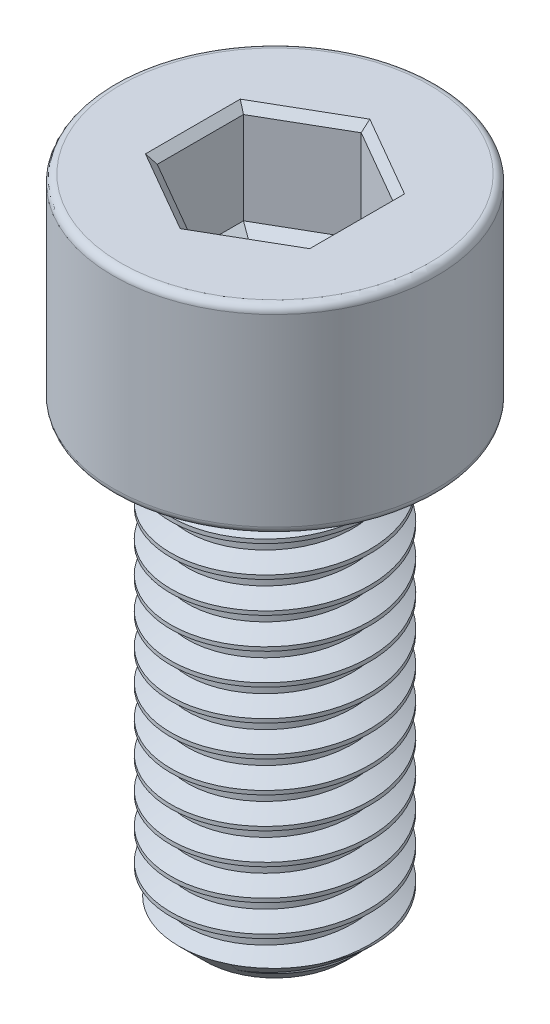
from build123d import *

# Parameters (mm, degrees)
SKETCH1_R           = 4
BOSS_EXTRUDE1_DEPTH = 18
THREAD1_PITCH       = 1.25
SKETCH2_R           = 6.5
BOSS_EXTRUDE2_DEPTH = 8
FILLET1_R           = 0.3
CUT_EXTRUDE1_DEPTH  = 4
CHAMFER1_SIZE       = 0.3
CUT_EXTRUDE2_DEPTH  = 0.4
CUT_EXTRUDE2_DRAFT  = -60


with BuildPart() as part:
    # Sketch1 → Boss-Extrude1 (new body)
    with BuildSketch(Plane(origin=(0, 0, 0), x_dir=(1, 0, 0), z_dir=(0, 1, 0))):
        with Locations(Location((0, 0, 0), (0, 0, 270))):
            Circle(SKETCH1_R)
    extrude(amount=BOSS_EXTRUDE1_DEPTH)

    # Thread1: the profile of Thread Profile1 profile screwed along a right-hand helix of 15.4 turns, 8 arcs to a turn; built about Z, then put on its axis
    thread1_z = Axis((0, 0, 0), (0, 0, 1))
    thread1_corners = [(4.0003, 0, -0.000173205), (4.0003, 0, 1.093923202), (3.323417656, 0, 0.703124998), (3.323417656, 0, 0.390624998)]
    with BuildLine(mode=Mode.PRIVATE) as thread1_profile:
        Line(thread1_corners[0], thread1_corners[1])
        Line(thread1_corners[1], thread1_corners[2])
        Line(thread1_corners[2], thread1_corners[3])
        Line(thread1_corners[3], thread1_corners[0])
    thread1_cap = Face(thread1_profile.wire())
    thread1_turn_angles = [0, 22.5, 45, 67.5, 90, 112.5, 135, 157.5, 180, 202.5, 225, 247.5, 270, 292.5, 315, 337.5, 360]
    thread1_turn_weights = [1, 0.9238795325112867, 1, 0.9238795325112867, 1, 0.9238795325112867, 1, 0.9238795325112867, 1, 0.9238795325112867, 1, 0.9238795325112867, 1, 0.9238795325112867, 1, 0.9238795325112867, 1]
    thread1_turn_rails = [Edge.make_bspline([Vector(p[0], p[1], 0).rotate(thread1_z, thread1_turn_angles[k]) / thread1_turn_weights[k] + Vector(0, 0, p[2] + THREAD1_PITCH * thread1_turn_angles[k] / 360) for k in range(17)], [0, 0, 0, 1, 1, 2, 2, 3, 3, 4, 4, 5, 5, 6, 6, 7, 7, 8, 8, 8], 2, thread1_turn_weights) for p in thread1_corners]
    thread1_turn_sides = [Face.make_surface_from_curves(thread1_turn_rails[p[0]], thread1_turn_rails[p[1]]) for p in [(0, 1), (1, 2), (2, 3), (3, 0)]]
    thread1_last_angles = [5400, 5422.5, 5445, 5467.5, 5490, 5512.5, 5535, 5539.5, 5544]
    thread1_last_weights = [1, 0.9238795325112867, 1, 0.9238795325112867, 1, 0.9238795325112867, 1, 0.996917333733128, 1]
    thread1_last_rails = [Edge.make_bspline([Vector(p[0], p[1], 0).rotate(thread1_z, thread1_last_angles[k]) / thread1_last_weights[k] + Vector(0, 0, p[2] + THREAD1_PITCH * thread1_last_angles[k] / 360) for k in range(9)], [0, 0, 0, 1, 1, 2, 2, 3, 3, 4, 4, 4], 2, thread1_last_weights) for p in thread1_corners]
    thread1_last_sides = [Face.make_surface_from_curves(thread1_last_rails[p[0]], thread1_last_rails[p[1]]) for p in [(0, 1), (1, 2), (2, 3), (3, 0)]]
    thread1 = Plane(origin=(0, 19.25, 0), x_dir=(-1, 0, 0), z_dir=(0, -1, 0)) * Solid(Shell([*[p.moved(Location((0, 0, THREAD1_PITCH * i))) for i in range(15) for p in thread1_turn_sides], *thread1_last_sides, thread1_cap, thread1_cap.rotate(thread1_z, 5544).moved(Location((0, 0, THREAD1_PITCH * 5544 / 360)))]))
    add(thread1, mode=Mode.SUBTRACT)

    # Sketch2 → Boss-Extrude2 (add)
    with BuildSketch(Plane(origin=(0, 18, 0), x_dir=(1, 0, 0), z_dir=(0, 1, 0))):
        with Locations(Location((0, 0, 0), (0, 0, 270))):
            Circle(SKETCH2_R)
    extrude(amount=BOSS_EXTRUDE2_DEPTH)

    # Sketch5 → Cut-Revolve1 (revolve, cut)
    with BuildSketch(Plane.XY, mode=Mode.PRIVATE) as cut_revolve1_sk:
        Polygon((4.01, 0), (4.01, 1.2), (2.81, 0), align=None)
    revolve(cut_revolve1_sk.sketch.rotate(Axis((0, 0, 0), (0, 1, 0)), 296.268443729), axis=Axis((0, 0, 0), (0, 1, 0)), mode=Mode.SUBTRACT)

    # Fillet1
    fillet1_edges = [part.edges().sort_by_distance(p)[0] for p in [
        (0, 18, -6.5),
        (0, 26, -6.5),
    ]]
    fillet(fillet1_edges, radius=FILLET1_R)

    # Sketch6 → Cut-Extrude1 (cut)
    with BuildSketch(Plane(origin=(0, 26, 0), x_dir=(1, 0, 0), z_dir=(0, 1, 0))):
        Polygon((0, 3.464101615), (-3, 1.732050808), (-3, -1.732050808), (0, -3.464101615), (3, -1.732050808), (3, 1.732050808), align=None)
    extrude(amount=-CUT_EXTRUDE1_DEPTH, mode=Mode.SUBTRACT)

    # Chamfer1
    chamfer1_edges = [part.edges().sort_by_distance(p)[0] for p in [
        (1.5, 26, -2.598076211),
        (-1.5, 26, -2.598076211),
        (-3, 26, 0),
        (-1.5, 26, 2.598076211),
        (1.5, 26, 2.598076211),
        (3, 26, 0),
    ]]
    chamfer(chamfer1_edges, length=CHAMFER1_SIZE)


with BuildPart() as cut_extrude2_tool:
    # Sketch7 → Cut-Extrude2 (with draft: the straight prism first)
    with BuildSketch(Plane(origin=(0, 22, 0), x_dir=(1, 0, 0), z_dir=(0, 1, 0))):
        Polygon((0, 3.464101615), (-3, 1.732050808), (-3, -1.732050808), (0, -3.464101615), (3, -1.732050808), (3, 1.732050808), align=None)
    extrude(amount=-CUT_EXTRUDE2_DEPTH)
    # Cut-Extrude2: the draft: its side faces are tilted about the plane it starts from
    cut_extrude2_sides = [cut_extrude2_tool.faces().sort_by_distance(p)[0] for p in [
        (-1.5, 21.8, -2.598076211),
        (-3, 21.8, 0),
        (-1.5, 21.8, 2.598076211),
        (1.5, 21.8, 2.598076211),
        (3, 21.8, 0),
        (1.5, 21.8, -2.598076211),
    ]]
    draft(cut_extrude2_sides, Plane(origin=(0, 22, 0), x_dir=(1, 0, 0), z_dir=(0, 1, 0)), CUT_EXTRUDE2_DRAFT)


with BuildPart() as part_1:
    add(part.part)

    # Cut-Extrude2: cut by cut_extrude2_tool
    add(cut_extrude2_tool.part, mode=Mode.SUBTRACT)


solid = part_1.part
